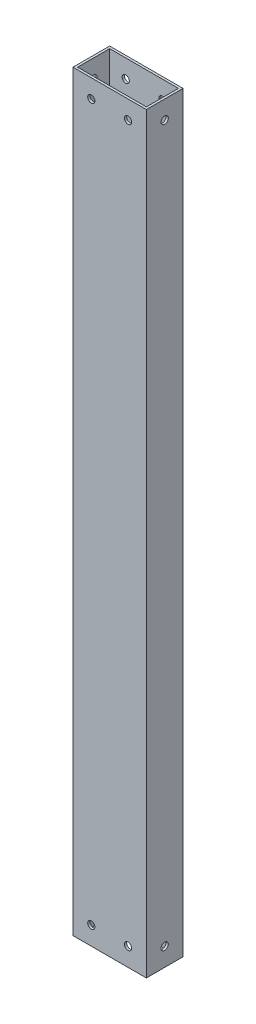
from build123d import *

# Parameters (mm, degrees)
SKETCH1_W               = 50.8
SKETCH1_H               = 520.7
BOSS_EXTRUDE1_DEPTH     = 12.7
SHELL1_T                = -1.5875
CUT_EXTRUDE1_DEPTH      = 262.894200967
CUT_EXTRUDE1_DEPTH_BACK = 262.894200967
SKETCH2_R               = 2.4892
CUT_EXTRUDE2_DEPTH      = 262.894200967
CUT_EXTRUDE2_DEPTH_BACK = 262.894200967
SKETCH3_R               = 2.4892


with BuildPart() as part:
    # Sketch1 → Boss-Extrude1 (new, symmetric)
    with BuildSketch(Plane.XY):
        Rectangle(SKETCH1_W, SKETCH1_H)
    extrude(amount=BOSS_EXTRUDE1_DEPTH, both=True)

    # Shell1
    shell1_openings = [part.faces().sort_by_distance(p)[0] for p in [
        (0, -260.35, 0),
        (0, 260.35, 0),
    ]]
    offset(amount=SHELL1_T, openings=shell1_openings, kind=Kind.INTERSECTION)

    # Sketch2 → Cut-Extrude1 (cut, two sides: drawn at the far end of the back side and taken through both)
    with BuildSketch(Plane.XY.offset(-CUT_EXTRUDE1_DEPTH_BACK)):
        with Locations((-12.7, -247.65)):
            Circle(SKETCH2_R)
        with Locations((12.7, -247.65)):
            Circle(SKETCH2_R)
        with Locations((12.7, 247.65)):
            Circle(SKETCH2_R)
        with Locations((-12.7, 247.65)):
            Circle(SKETCH2_R)
    extrude(amount=CUT_EXTRUDE1_DEPTH + CUT_EXTRUDE1_DEPTH_BACK, mode=Mode.SUBTRACT)

    # Sketch3 → Cut-Extrude2 (cut, two sides: drawn at the far end of the back side and taken through both)
    with BuildSketch(Plane(origin=(0, 0, 0), x_dir=(0, 0, -1), z_dir=(1, 0, 0)).offset(-CUT_EXTRUDE2_DEPTH_BACK)):
        with Locations((0, -247.65)):
            Circle(SKETCH3_R)
        with Locations((0, 247.65)):
            Circle(SKETCH3_R)
    extrude(amount=CUT_EXTRUDE2_DEPTH + CUT_EXTRUDE2_DEPTH_BACK, mode=Mode.SUBTRACT)


solid = part.part
